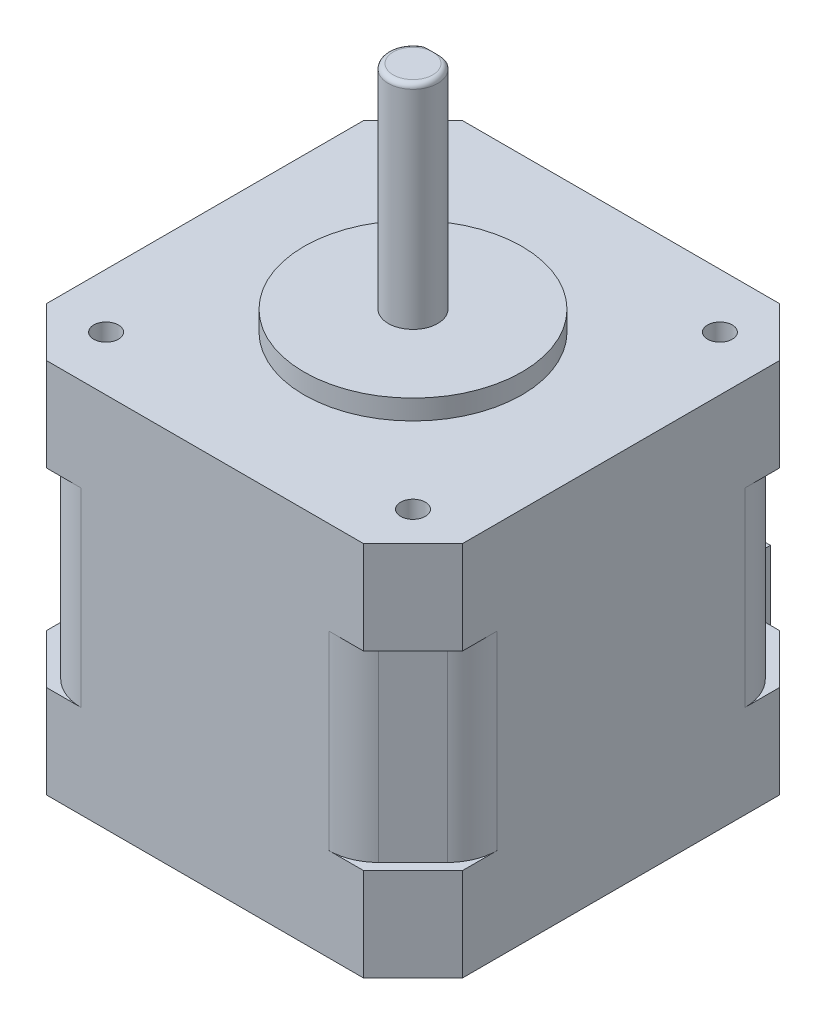
from build123d import *

# Parameters (mm, degrees)
SKETCH1_W             = 42
SKETCH1_H             = 42
BOSS_EXTRUDE1_DEPTH   = 38
SKETCH2_R             = 11
BOSS_EXTRUDE2_DEPTH   = 2
SKETCH3_R             = 2.5
BOSS_EXTRUDE3_DEPTH   = 3.5
BOSS_EXTRUDE4_DEPTH   = 18
M3_TAPPED_HOLE1_D     = 2.5
M3_TAPPED_HOLE1_DEPTH = 5
M3_TAPPED_HOLE1_TIP   = 0.751075774
CHAMFER1_SIZE         = 5
SKETCH11_W            = 10
SKETCH11_H            = 19.2
CUT_EXTRUDE2_DEPTH    = 1
SKETCH12_W            = 10
SKETCH12_H            = 19.2
CUT_EXTRUDE3_DEPTH    = 1
SKETCH13_W            = 10
SKETCH13_H            = 19.2
CUT_EXTRUDE4_DEPTH    = 1
SKETCH14_W            = 10
SKETCH14_H            = 19.2
CUT_EXTRUDE5_DEPTH    = 1
FILLET1_R             = 5
SKETCH15_W            = 16.2
SKETCH15_H            = 9.4
BOSS_EXTRUDE5_DEPTH   = 7
FILLET3_R             = 0.5


with BuildPart() as part:
    # Sketch1 → Boss-Extrude1 (new body)
    with BuildSketch(Plane(origin=(0, 0, 0), x_dir=(1, 0, 0), z_dir=(0, 1, 0))):
        Rectangle(SKETCH1_W, SKETCH1_H)
    extrude(amount=BOSS_EXTRUDE1_DEPTH)

    # Sketch2 → Boss-Extrude2 (add)
    with BuildSketch(Plane(origin=(0, 38, 0), x_dir=(1, 0, 0), z_dir=(0, 1, 0))):
        with Locations(Location((0, 0, 0), (0, 0, 270))):
            Circle(SKETCH2_R)
    extrude(amount=BOSS_EXTRUDE2_DEPTH)

    # Sketch3 → Boss-Extrude3 (add)
    with BuildSketch(Plane(origin=(0, 40, 0), x_dir=(1, 0, 0), z_dir=(0, 1, 0))):
        with Locations(Location((0, 0, 0), (0, 0, 270))):
            Circle(SKETCH3_R)
    extrude(amount=BOSS_EXTRUDE3_DEPTH)

    # Sketch4 → Boss-Extrude4 (add)
    with BuildSketch(Plane(origin=(0, 43.5, 0), x_dir=(1, 0, 0), z_dir=(0, 1, 0))):
        with BuildLine():
            ThreePointArc((-1.5, 2), (-2.371708245, -0.790569415), (0, -2.5))
            Line((0, -2.5), (0, 2))
            Line((0, 2), (-1.5, 2))
        make_face()
        with BuildLine():
            Line((0, 2), (0, -2.5))
            ThreePointArc((0, -2.5), (1.767766953, -1.767766953), (2.5, 0))
            ThreePointArc((2.5, 0), (2.236067977, 1.118033989), (1.5, 2))
            Line((1.5, 2), (0, 2))
        make_face()
    extrude(amount=BOSS_EXTRUDE4_DEPTH)

    # M3 Tapped Hole1
    with Locations(Plane(origin=(0, 38, 0), x_dir=(1, 0, 0), z_dir=(0, 1, 0))):
        with Locations((-15.5, 15.5), (15.5, 15.5), (15.5, -15.5), (-15.5, -15.5)):
            Hole(M3_TAPPED_HOLE1_D / 2, depth=M3_TAPPED_HOLE1_DEPTH)
            with Locations((0, 0, -(M3_TAPPED_HOLE1_DEPTH + M3_TAPPED_HOLE1_TIP / 2))):  # 118° drill point
                Cone(0, M3_TAPPED_HOLE1_D / 2, M3_TAPPED_HOLE1_TIP, mode=Mode.SUBTRACT)

    # Chamfer1
    chamfer1_edges = [part.edges().sort_by_distance(p)[0] for p in [
        (-21, 19, -21),
        (21, 19, -21),
        (21, 19, 21),
        (-21, 19, 21),
    ]]
    chamfer(chamfer1_edges, length=CHAMFER1_SIZE)

    # Sketch11 → Cut-Extrude2 (cut)
    with BuildSketch(Plane(origin=(18.5, 0, 18.5), x_dir=(0.7071067811865485, 0, -0.7071067811865467), z_dir=(0.7071067811865467, 0, 0.7071067811865485))):
        with Locations((0, 19)):
            Rectangle(SKETCH11_W, SKETCH11_H)
    extrude(amount=-CUT_EXTRUDE2_DEPTH, mode=Mode.SUBTRACT)

    # Sketch12 → Cut-Extrude3 (cut)
    with BuildSketch(Plane(origin=(-18.5, 0, 18.5), x_dir=(0.7071067811865465, 0, 0.7071067811865487), z_dir=(-0.7071067811865487, 0, 0.7071067811865465))):
        with Locations((0, 19)):
            Rectangle(SKETCH12_W, SKETCH12_H)
    extrude(amount=-CUT_EXTRUDE3_DEPTH, mode=Mode.SUBTRACT)

    # Sketch13 → Cut-Extrude4 (cut)
    with BuildSketch(Plane(origin=(-18.5, 0, -18.5), x_dir=(-0.7071067811865485, 0, 0.7071067811865467), z_dir=(-0.7071067811865467, 0, -0.7071067811865485))):
        with Locations((0, 19)):
            Rectangle(SKETCH13_W, SKETCH13_H)
    extrude(amount=-CUT_EXTRUDE4_DEPTH, mode=Mode.SUBTRACT)

    # Sketch14 → Cut-Extrude5 (cut)
    with BuildSketch(Plane(origin=(18.5, 0, -18.5), x_dir=(-0.7071067811865467, 0, -0.7071067811865485), z_dir=(0.7071067811865485, 0, -0.7071067811865467))):
        with Locations((0, 19)):
            Rectangle(SKETCH14_W, SKETCH14_H)
    extrude(amount=-CUT_EXTRUDE5_DEPTH, mode=Mode.SUBTRACT)

    # Fillet1
    fillet1_edges = [part.edges().sort_by_distance(p)[0] for p in [
        (-14.585786438, 19, 21),
        (-21, 19, 14.585786438),
        (-14.585786438, 19, -21),
        (-21, 19, -14.585786438),
        (14.585786438, 19, -21),
        (21, 19, -14.585786438),
        (21, 19, 14.585786438),
        (14.585786438, 19, 21),
    ]]
    fillet(fillet1_edges, radius=FILLET1_R)

    # Sketch15 → Boss-Extrude5 (add)
    with BuildSketch(Plane(origin=(0, 0, -21), x_dir=(-1, 0, 0), z_dir=(0, 0, -1))):
        with Locations((0, 4.7)):
            Rectangle(SKETCH15_W, SKETCH15_H)
    extrude(amount=BOSS_EXTRUDE5_DEPTH)

    # Fillet3
    # the kernel refuses this fillet: 0.5 mm, written as the material it takes off along each edge
    with BuildSketch(Plane(origin=(0, 61.5, 0), x_dir=(0.14099255813885567, 0, -0.990010655775715), z_dir=(-0.990010655775715, 0, -0.14099255813885567))) as fillet3_piece_1:
        with BuildLine():
            CenterArc((2.5 - FILLET3_R, FILLET3_R), FILLET3_R, 270, 90)
            Line((2.5 - FILLET3_R, 0), (2.5, 0))
            Line((2.5, 0), (2.5, FILLET3_R))
        make_face()
    revolve(axis=Axis((0, 61.5, 0), (0, -1, 0)), revolution_arc=343.789429262, mode=Mode.SUBTRACT)


solid = part.part
